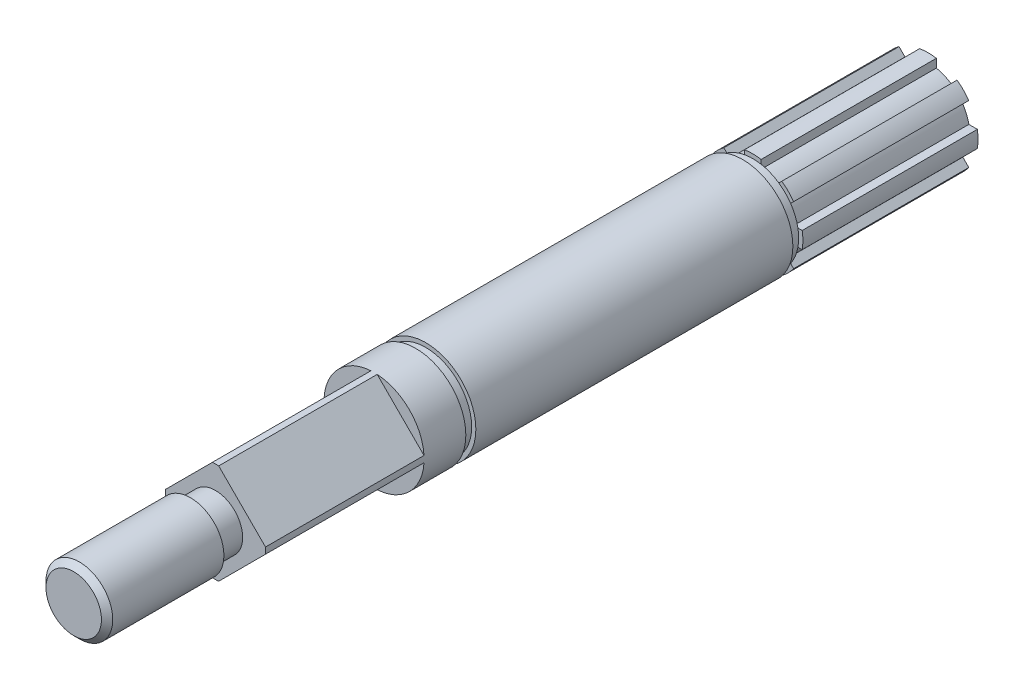
from build123d import *

# Parameters (mm, degrees)
SKETCH_1_R               = 5
EXTRUDE_1_DEPTH          = 21
SKETCH_2_R               = 5.5
EXTRUDE_2_DEPTH          = 1.2
SKETCH_3_R               = 6
EXTRUDE_3_DEPTH          = 38
SKETCH_4_R               = 5.5
EXTRUDE_4_DEPTH          = 1.2
SKETCH_5_R               = 6
EXTRUDE_5_DEPTH          = 24
SKETCH_6_R               = 3.25
EXTRUDE_6_DEPTH          = 3
SKETCH_7_R               = 4
EXTRUDE_7_DEPTH          = 14
SKETCH_9_OUTSIDE_W       = 34.76
SKETCH_9_OUTSIDE_H       = 34.76
CUT_EXTRUDE_1_DEPTH      = 19
EXTRUDE_8_DEPTH          = 21
PATTERN_CIRCULAR_1_COUNT = 8


# Read off the part's stored shape, not the designer's step: M8 机械螺纹 螺柱1
with BuildPart() as part:
    # 草图1 → 凸台-拉伸1 (new body)
    with BuildSketch(Plane.XY):
        with Locations(Location((0, 0, 0), (0, 0, 180))):
            Circle(SKETCH_1_R)
    extrude(amount=EXTRUDE_1_DEPTH)

    # 草图2 → 凸台-拉伸2 (add)
    with BuildSketch(Plane.XY.offset(21)):
        Circle(SKETCH_2_R)
    extrude(amount=EXTRUDE_2_DEPTH)

    # 草图3 → 凸台-拉伸3 (add)
    with BuildSketch(Plane.XY.offset(22.2)):
        Circle(SKETCH_3_R)
    extrude(amount=EXTRUDE_3_DEPTH)

    # 草图4 → 凸台-拉伸4 (add)
    with BuildSketch(Plane.XY.offset(60.2)):
        Circle(SKETCH_4_R)
    extrude(amount=EXTRUDE_4_DEPTH)

    # 草图5 → 凸台-拉伸5 (add)
    with BuildSketch(Plane.XY.offset(61.4)):
        Circle(SKETCH_5_R)
    extrude(amount=EXTRUDE_5_DEPTH)

    # 草图6 → 凸台-拉伸6 (add)
    with BuildSketch(Plane.XY.offset(85.4)):
        Circle(SKETCH_6_R)
    extrude(amount=EXTRUDE_6_DEPTH)

    # 草图7 → 凸台-拉伸7 (add)
    with BuildSketch(Plane.XY.offset(88.4)):
        Circle(SKETCH_7_R)
    extrude(amount=EXTRUDE_7_DEPTH)

    # M8 机械螺纹 螺柱1 outline → M8 机械螺纹 螺柱1 (revolve, cut)
    with BuildSketch(Plane.XZ):
        Polygon((4, 102.4), (3.3235, 102.4), (4, 101.7235), align=None)
    revolve(axis=Axis((0, 0, 0), (0, 0, 1)), mode=Mode.SUBTRACT)

    # 草图9 outside → 切除-拉伸1 (cut)
    with BuildSketch(Plane.XY.offset(85.4)):
        Rectangle(SKETCH_9_OUTSIDE_W, SKETCH_9_OUTSIDE_H)
        Polygon((0, -6.363961031), (6.363961031, 0), (0, 6.363961031), (-6.363961031, 0), align=None, mode=Mode.SUBTRACT)
    extrude(amount=-CUT_EXTRUDE_1_DEPTH, mode=Mode.SUBTRACT)

    # 草图10 → 凸台-拉伸8 (add)
    with BuildSketch(Plane(origin=(0, 0, 0), x_dir=(-1, 0, 0), z_dir=(0, 0, -1))):
        with BuildLine():
            ThreePointArc((1, 5.916079783), (0, 6), (-1, 5.916079783))
            Line((-1, 5.916079783), (-1, 4.898979486))
            ThreePointArc((-1, 4.898979486), (0, 5), (1, 4.898979486))
            Line((1, 4.898979486), (1, 5.916079783))
        make_face()
    extrude_8 = extrude(amount=-EXTRUDE_8_DEPTH)

    # 阵列(圆周)1: 凸台-拉伸8 ×8 about axis
    pattern_circular_1_axis = Axis((0, 0, 0), (0, 0, 1))
    for i in range(1, PATTERN_CIRCULAR_1_COUNT):
        add(extrude_8.rotate(pattern_circular_1_axis, i * 360 / PATTERN_CIRCULAR_1_COUNT))


solid = part.part
